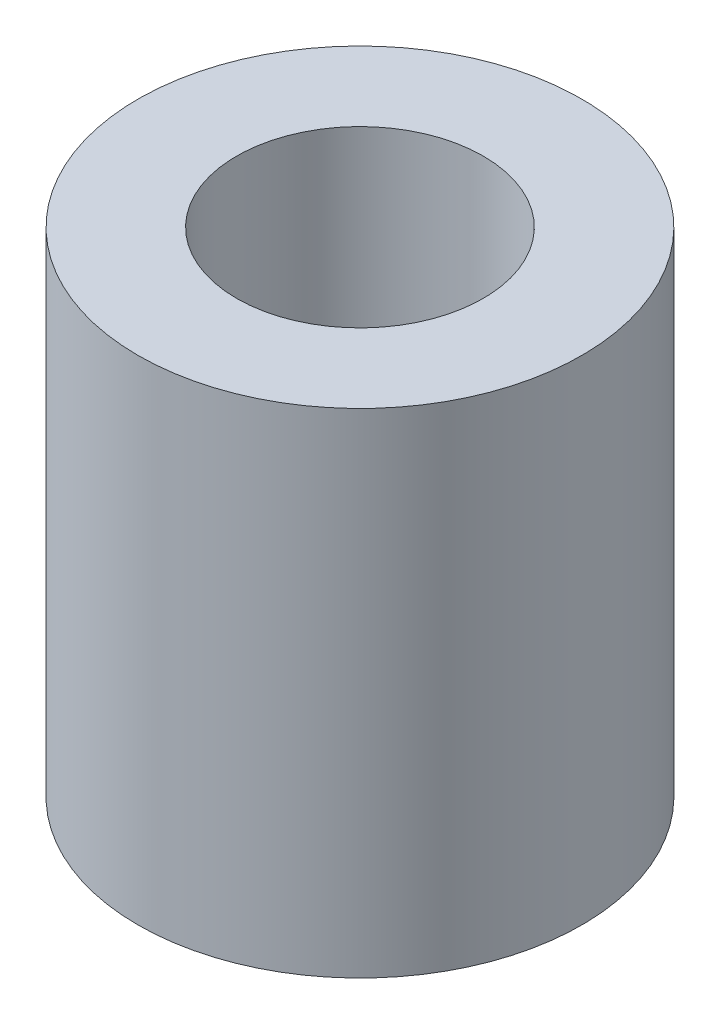
from build123d import *

# Parameters (mm, degrees)
SKETCH1_R           = 4.5
SKETCH1_R_2         = 2.5
BOSS_EXTRUDE1_DEPTH = 5


with BuildPart() as part:
    # Sketch1 → Boss-Extrude1 (new, symmetric)
    with BuildSketch(Plane(origin=(0, 0, 0), x_dir=(1, 0, 0), z_dir=(0, 1, 0))):
        Circle(SKETCH1_R)
        Circle(SKETCH1_R_2, mode=Mode.SUBTRACT)
    extrude(amount=BOSS_EXTRUDE1_DEPTH, both=True)


solid = part.part
